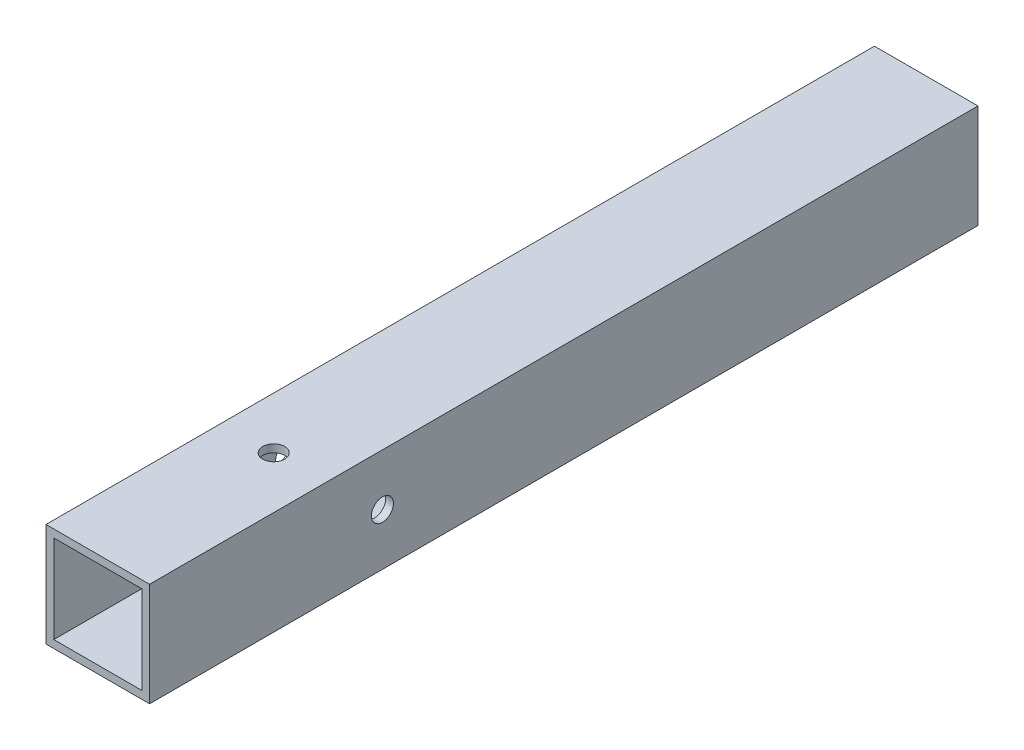
from build123d import *

# Parameters (mm, degrees)
SKETCH1_W           = 20
SKETCH1_H           = 20
SKETCH1_W_2         = 17
SKETCH1_H_2         = 17
BOSS_EXTRUDE1_DEPTH = 160
SKETCH2_R           = 2.125
CUT_EXTRUDE1_DEPTH  = 162.554944214
SKETCH3_R           = 2.125
CUT_EXTRUDE2_DEPTH  = 162.554944214


with BuildPart() as part:
    # Sketch1 → Boss-Extrude1 (new body)
    with BuildSketch(Plane.XY):
        Rectangle(SKETCH1_W, SKETCH1_H)
        Rectangle(SKETCH1_W_2, SKETCH1_H_2, mode=Mode.SUBTRACT)
    extrude(amount=-BOSS_EXTRUDE1_DEPTH)

    # Sketch2 → Cut-Extrude1 (cut, through all)
    with BuildSketch(Plane(origin=(0, 10, 0), x_dir=(1, 0, 0), z_dir=(0, 1, 0))):
        with Locations((0, 33.975)):
            Circle(SKETCH2_R)
    extrude(amount=-CUT_EXTRUDE1_DEPTH, mode=Mode.SUBTRACT)

    # Sketch3 → Cut-Extrude2 (cut, through all)
    with BuildSketch(Plane.ZY.offset(10)):
        with Locations((-44.975, 0)):
            Circle(SKETCH3_R)
    extrude(amount=-CUT_EXTRUDE2_DEPTH, mode=Mode.SUBTRACT)


solid = part.part
